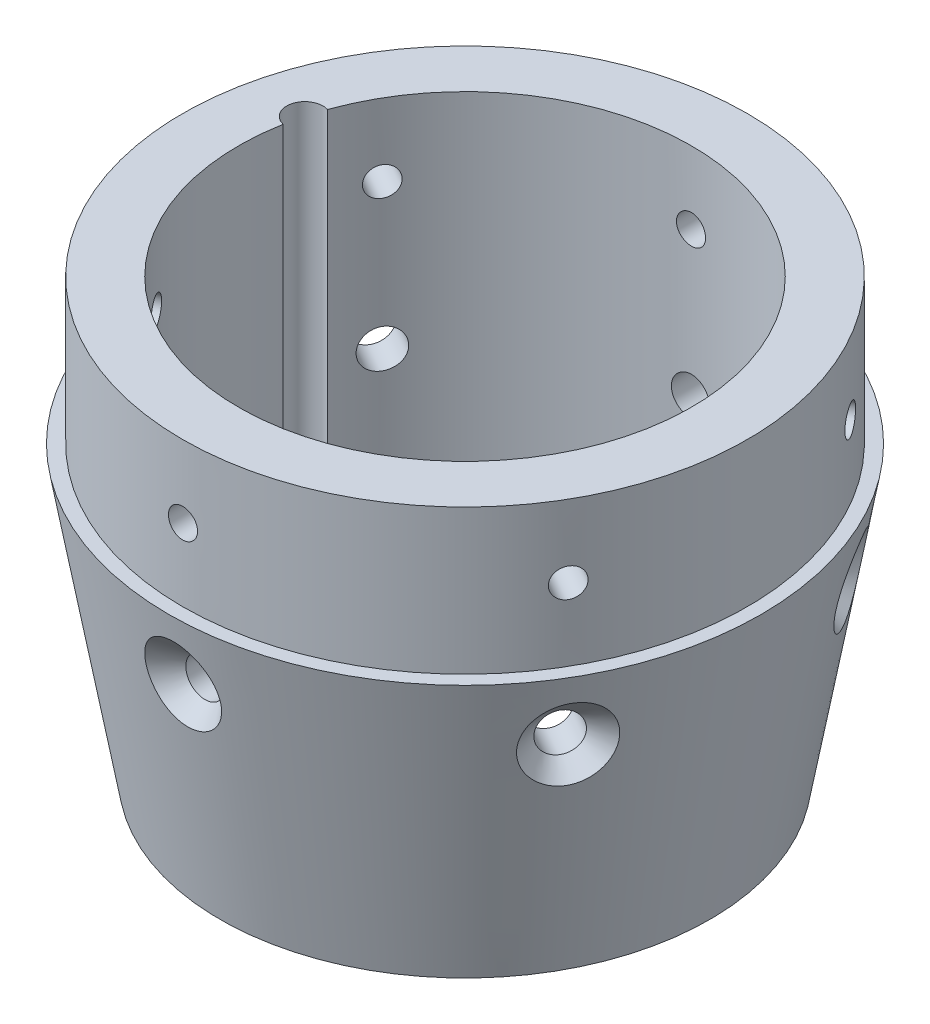
from build123d import *

# Parameters (mm, degrees)
TAP_DRILL_FOR_1_4_20_TAP1_REACH  = 139.089
TAP_DRILL_FOR_1_4_20_TAP1_BORE_R = 2.5527
CIRPATTERN1_COUNT                = 6
SKETCH12_R                       = 3.175
CUT_EXTRUDE2_DEPTH               = 106.817363488
CIRPATTERN2_COUNT                = 6


# Read off the part's stored shape, not the designer's step: CSK for 1/4 Flat Head Machine Screw1
with BuildPart() as part:
    # Sketch1 → Revolve1 (revolve)
    with BuildSketch(Plane.XY, mode=Mode.PRIVATE) as revolve1_sk:
        Polygon((-51.9176, 50.8), (-49.53, 50.8), (-49.53, 76.2), (-39.7256, 76.2), (-39.7256, 0), (-42.96018938, 0), align=None)
    revolve(revolve1_sk.sketch.rotate(Axis((0, 0, 0), (0, 1, 0)), 270), axis=Axis((0, 0, 0), (0, 1, 0)))

    # Tap Drill for 1/4-20 Tap1 bore → Tap Drill for 1/4-20 Tap1 (cut, up to next)
    with BuildSketch(Plane.XY.offset(49.53), mode=Mode.PRIVATE) as tap_drill_for_1_4_20_tap1_sk1:
        with Locations((0, 63.5)):
            Circle(TAP_DRILL_FOR_1_4_20_TAP1_BORE_R)
    tap_drill_for_1_4_20_tap1_tool1 = extrude(tap_drill_for_1_4_20_tap1_sk1.sketch, amount=-TAP_DRILL_FOR_1_4_20_TAP1_REACH, mode=Mode.PRIVATE) & part.part
    tap_drill_for_1_4_20_tap1 = tap_drill_for_1_4_20_tap1_tool1.solids().sort_by_distance((0, 63.5, 49.53))[0]
    add(tap_drill_for_1_4_20_tap1, mode=Mode.SUBTRACT)

    # CirPattern1: Tap Drill for 1/4-20 Tap1 ×6 about axis
    cirpattern1_axis = Axis((0, 0, 0), (0, -1, 0))
    for i in range(1, CIRPATTERN1_COUNT):
        add(tap_drill_for_1_4_20_tap1.rotate(cirpattern1_axis, i * 360 / CIRPATTERN1_COUNT), mode=Mode.SUBTRACT)

    # CSK for 1/4 Flat Head Machine Screw1 out → CSK for 1/4 Flat Head Machine Screw1 (revolve, cut)
    with BuildSketch(Plane.XZ.offset(-38.1)):
        Polygon((0, -39.581641936), (0, -49.1184092), (6.438900101, -49.118409195), (3.3782, -45.597476597), (3.3782, -39.581641936), align=None)
    csk_for_1_4_flat_head_machine_screw1 = revolve(axis=Axis((0, 38.1, 0), (0, 0, 1)), mode=Mode.SUBTRACT)

    # Sketch12 → Cut-Extrude2 (cut, through all)
    with BuildSketch(Plane(origin=(0, 76.2, 0), x_dir=(1, 0, 0), z_dir=(0, 1, 0))):
        with Locations((-38.371983005, 10.281741858)):
            Circle(SKETCH12_R)
    extrude(amount=-CUT_EXTRUDE2_DEPTH, mode=Mode.SUBTRACT)

    # Sketch13 → Cut-Revolve1 (revolve, cut)
    with BuildSketch(Plane(origin=(0, 0, 0), x_dir=(0, 0, -1), z_dir=(1, 0, 0)), mode=Mode.PRIVATE) as cut_revolve1_sk:
        Polygon((49.118409181, 44.5389), (52.293409181, 47.298885393), (52.293409181, 38.1), (49.118409181, 38.1), align=None)
    cut_revolve1 = revolve(cut_revolve1_sk.sketch.rotate(Axis((0, 38.1, -39.6875), (0, 0, -1)), 270), axis=Axis((0, 38.1, -39.6875), (0, 0, -1)), mode=Mode.SUBTRACT)

    # CirPattern2: CSK for 1/4 Flat Head Machine Screw1, Cut-Revolve1 ×6 about axis
    cirpattern2_axis = Axis((0, 0, 0), (0, -1, 0))
    add([csk_for_1_4_flat_head_machine_screw1.rotate(cirpattern2_axis, i * 360 / CIRPATTERN2_COUNT) for i in range(1, CIRPATTERN2_COUNT)], mode=Mode.SUBTRACT)
    add([cut_revolve1.rotate(cirpattern2_axis, i * 360 / CIRPATTERN2_COUNT) for i in range(1, CIRPATTERN2_COUNT)], mode=Mode.SUBTRACT)


solid = part.part
